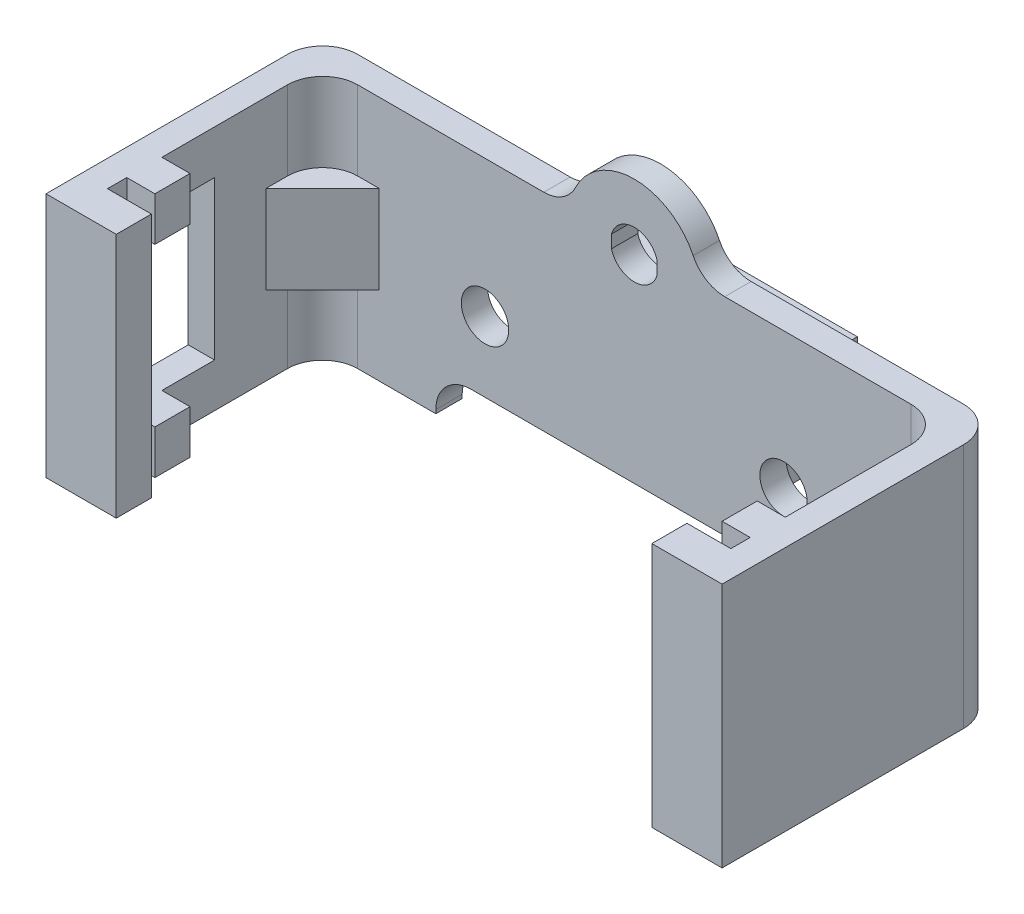
from build123d import *

# Parameters (mm, degrees)
SKETCH_1_W               = 27
SKETCH_1_H               = 17
EXTRUDE_1_DEPTH          = 1
SKETCH_2_R               = 2.55
CUT_EXTRUDE_1_DEPTH      = 16.984367363
EXTRUDE_2_DEPTH          = 17
SKETCH_6_W               = 1.5
SKETCH_6_H               = 2
EXTRUDE_3_DEPTH          = 2
CHAMFER_1_SIZE           = 1
CUT_EXTRUDE_4_REACH      = 39.316
SKETCH_8_R               = 2
FILLET_1_R               = 3
SKETCH_9_W               = 7
SKETCH_9_H               = 13
EXTRUDE_4_DEPTH          = 1.5
SKETCH_7_R               = 1.35
CUT_EXTRUDE_5_DEPTH      = 10
CUT_EXTRUDE_6_REACH      = 41.373
FILLET_2_R               = 2.2
SKETCH_13_W              = 11.6
SKETCH_13_H              = 5.4
EXTRUDE_6_DEPTH          = 5.4
CUT_EXTRUDE_7_DEPTH      = 45.299097095
CUT_EXTRUDE_7_DEPTH_BACK = 45.299097095
SKETCH_14_OUTSIDE_W      = 46.85
SKETCH_14_OUTSIDE_H      = 49.25
SKETCH_14_OUTSIDE_W_2    = 27
SKETCH_14_OUTSIDE_H_2    = 6.9
EXTRUDE_7_DEPTH          = 3.5
EXTRUDE_7_DEPTH_BACK     = 10.5
SKETCH_16_W              = 5.6
SKETCH_16_H              = 1.5
SKETCH_16_W_2            = 4.4
SKETCH_16_W_3            = 12.2
EXTRUDE_8_DEPTH          = 2
EXTRUDE_9_DEPTH          = 2.5
CUT_EXTRUDE_8_REACH      = 55.893
SKETCH_18_W              = 5
SKETCH_18_H              = 9
EXTRUDE_START            = -1.5
SKETCH_19_R              = 3.726433752
SKETCH_19_R_2            = 1.35
SKETCH_19_W              = 24.8
SKETCH_19_H              = 1.288897449
EXTRUDE_10_DEPTH         = 1.5
FILLET_4_R               = 2


# Some blends are built 0.0001 mm under size
with BuildPart() as part:
    # 草图1 → 凸台-拉伸1 (new body)
    with BuildSketch(Plane.XY):
        Rectangle(SKETCH_1_W, SKETCH_1_H)
    extrude(amount=EXTRUDE_1_DEPTH)

    # 草图2 → 切除-拉伸1 (cut, through all)
    with BuildSketch(Plane.XY.offset(1)):
        with Locations((0, 4.125)):
            Circle(SKETCH_2_R)
        with Locations((0, -4.125)):
            Circle(SKETCH_2_R)
        with Locations((8.27, 4.125)):
            Circle(SKETCH_2_R)
        with Locations((8.27, -4.125)):
            Circle(SKETCH_2_R)
        with Locations((-8.27, 4.125)):
            Circle(SKETCH_2_R)
        with Locations((-8.27, -4.125)):
            Circle(SKETCH_2_R)
    extrude(amount=-CUT_EXTRUDE_1_DEPTH, mode=Mode.SUBTRACT)

    # 草图3 → 凸台-拉伸2 (add)
    with BuildSketch(Plane.XZ.offset(8.5)):
        Polygon((13.5, 0), (19, 0), (19, -28.5), (-13.5, -28.5), (-13.5, -30), (20.5, -30), (20.5, 1), (13.5, 1), align=None)
    extrude(amount=-EXTRUDE_2_DEPTH)

    # 草图6 → 凸台-拉伸3 (add, symmetric)
    with BuildSketch(Plane(origin=(0, 0, 0), x_dir=(1, 0, 0), z_dir=(0, 1, 0))):
        Polygon((19, 0), (19, 5), (14, 0), align=None)
        Polygon((19, 28.5), (14, 28.5), (19, 23.5), align=None)
        with Locations((18.25, 20)):
            Rectangle(SKETCH_6_W, SKETCH_6_H)
    extrude(amount=EXTRUDE_3_DEPTH, both=True)

    # 倒角1
    chamfer_1_edges = [part.edges().sort_by_distance(p)[0] for p in [
        (-13.5, 0, 0),
    ]]
    chamfer(chamfer_1_edges, length=CHAMFER_1_SIZE - 0.0001)  # a hair under: the kernel refuses the full size

    # 草图8 → 切除-拉伸4 (cut, up to next)
    with BuildSketch(Plane(origin=(0, 0, 0), x_dir=(-1, 0, 0), z_dir=(0, 0, -1)), mode=Mode.PRIVATE) as cut_extrude_4_sk1:
        Circle(SKETCH_8_R)
    cut_extrude_4_tool1 = extrude(cut_extrude_4_sk1.sketch, amount=-CUT_EXTRUDE_4_REACH, mode=Mode.PRIVATE) & part.part
    add(cut_extrude_4_tool1.solids().sort_by_distance((0, 0, 0))[0], mode=Mode.SUBTRACT)

    # 圆角1
    fillet_1_edges = [part.edges().sort_by_distance(p)[0] for p in [
        (20.5, 0, 1),
        (20.5, 0, -30),
        (19, 5.25, -28.5),
        (19, 5.25, 0),
        (19, -5.25, 0),
        (19, -5.25, -28.5),
    ]]
    fillet(fillet_1_edges, radius=FILLET_1_R)

    # 草图9 → 凸台-拉伸4 (add)
    with BuildSketch(Plane(origin=(0, 0, -30), x_dir=(-1, 0, 0), z_dir=(0, 0, -1))):
        with Locations((0, 6.5)):
            Rectangle(SKETCH_9_W, SKETCH_9_H)
    extrude(amount=-EXTRUDE_4_DEPTH)

    # 草图7 → 切除-拉伸5 (cut)
    with BuildSketch(Plane(origin=(0, 0, -30), x_dir=(-1, 0, 0), z_dir=(0, 0, -1))):
        with Locations((0, 10)):
            Circle(SKETCH_7_R)
        with Locations((-8.5, 2.7)):
            Circle(SKETCH_7_R)
        with Locations((8.5, 2.7)):
            Circle(SKETCH_7_R)
    extrude(amount=-CUT_EXTRUDE_5_DEPTH, mode=Mode.SUBTRACT)

    # 草图11 → 切除-拉伸6 (cut, up to next)
    with BuildSketch(Plane(origin=(0, 0, -30), x_dir=(-1, 0, 0), z_dir=(0, 0, -1)), mode=Mode.PRIVATE) as cut_extrude_6_sk1:
        with BuildLine():
            Line((13.5, -8.5), (13.5, 0))
            Line((13.5, 0), (-9, 0))
            ThreePointArc((-9, 0), (-15.01040764, -2.48959236), (-17.5, -8.5))
            Line((-17.5, -8.5), (13.5, -8.5))
        make_face()
    cut_extrude_6_tool1 = extrude(cut_extrude_6_sk1.sketch, amount=-CUT_EXTRUDE_6_REACH, mode=Mode.PRIVATE) & part.part
    add(cut_extrude_6_tool1.solids().sort_by_distance((1.149624, -4.397011, -30))[0], mode=Mode.SUBTRACT)

    # 圆角2
    fillet_2_edges = [part.edges().sort_by_distance(p)[0] for p in [
        (-3.5, 13, -29.25),
        (-3.5, 8.5, -29.25),
        (3.5, 13, -29.25),
        (3.5, 8.5, -29.25),
        (-13.5, 0, -29.25),
        (-13.5, 8.5, -29.25),
    ]]
    fillet(fillet_2_edges, radius=FILLET_2_R)

    # 草图13 → 凸台-拉伸6 (add)
    with BuildSketch(Plane(origin=(0, 0, -30), x_dir=(-1, 0, 0), z_dir=(0, 0, -1))):
        with Locations((0, 2.7)):
            Rectangle(SKETCH_13_W, SKETCH_13_H)
    extrude(amount=EXTRUDE_6_DEPTH)

    # 草图14 outside → 切除-拉伸7 (cut, two sides: drawn at the far end of the back side and taken through both)
    with BuildSketch(Plane(origin=(0, 8.5, 0), x_dir=(1, 0, 0), z_dir=(0, 1, 0)).offset(-CUT_EXTRUDE_7_DEPTH_BACK)):
        with Locations((3.5, 17.2)):
            Rectangle(SKETCH_14_OUTSIDE_W, SKETCH_14_OUTSIDE_H)
        with Locations((0, 31.95)):
            Rectangle(SKETCH_14_OUTSIDE_W_2, SKETCH_14_OUTSIDE_H_2, mode=Mode.SUBTRACT)
    extrude(amount=CUT_EXTRUDE_7_DEPTH + CUT_EXTRUDE_7_DEPTH_BACK, mode=Mode.SUBTRACT)

    # 草图15 → 凸台-拉伸7 (add, two sides: drawn at the far end of the back side and taken through both)
    with BuildSketch(Plane.XZ.offset(-EXTRUDE_7_DEPTH_BACK)):
        Polygon((-19.25, -14.25), (-19.25, -30), (-11.3, -30), (-11.3, -28.5), (-17.75, -28.5), (-17.75, -19.35), (-16.15, -19.35), (-16.15, -17.35), (-17.75, -17.35), (-17.75, -16.25), (-15.25, -16.25), (-15.25, -14.25), align=None)
        Polygon((17.75, -28.5), (13.5, -28.5), (13.5, -30), (19.25, -30), (19.25, -14.25), (15.25, -14.25), (15.25, -16.25), (17.75, -16.25), (17.75, -17.35), (16.15, -17.35), (16.15, -19.35), (17.75, -19.35), align=None)
    extrude(amount=EXTRUDE_7_DEPTH + EXTRUDE_7_DEPTH_BACK)

    # 草图16 → 凸台-拉伸8 (add)
    with BuildSketch(Plane(origin=(0, 8.5, 0), x_dir=(1, 0, 0), z_dir=(0, 1, 0))):
        with Locations((-8.5, 29.25)):
            Rectangle(SKETCH_16_W, SKETCH_16_H)
        with Locations((-3.5, 29.25)):
            Rectangle(SKETCH_16_W_2, SKETCH_16_H)
        with Locations((7.4, 29.25)):
            Rectangle(SKETCH_16_W_3, SKETCH_16_H)
    extrude(amount=EXTRUDE_8_DEPTH)

    # 草图17 → 凸台-拉伸9 (add, symmetric)
    with BuildSketch(Plane(origin=(0, 3.5, 0), x_dir=(-1, 0, 0), z_dir=(0, -1, 0))):
        Polygon((17.75, 25.275), (14.525, 28.5), (17.75, 28.5), align=None)
        Polygon((-17.75, 25.275), (-17.75, 28.5), (-14.525, 28.5), align=None)
    extrude(amount=EXTRUDE_9_DEPTH, both=True)

    # 草图18 → 切除-拉伸8 (cut, up to next)
    with BuildSketch(Plane.ZY.offset(19.25), mode=Mode.PRIVATE) as cut_extrude_8_sk1:
        with Locations((-19.85, 3.5)):
            Rectangle(SKETCH_18_W, SKETCH_18_H)
    cut_extrude_8_tool1 = extrude(cut_extrude_8_sk1.sketch, amount=-CUT_EXTRUDE_8_REACH, mode=Mode.PRIVATE) & part.part
    add(cut_extrude_8_tool1.solids().sort_by_distance((-19.25, 3.5, -19.85))[0], mode=Mode.SUBTRACT)

    # 草图19 → 凸台-拉伸10 (add)
    # profile 1 of 2: a face of its own
    with BuildSketch(Plane.XY.offset(-28.5).offset(EXTRUDE_START)):
        with Locations((0, 10)):
            Circle(SKETCH_19_R)
        with Locations((0, 10)):
            Circle(SKETCH_19_R_2, mode=Mode.SUBTRACT)
    # profile 2 of 2: a face of its own
    with BuildSketch(Plane.XY.offset(-28.5).offset(EXTRUDE_START)):
        with Locations((1.1, -0.644448725)):
            Rectangle(SKETCH_19_W, SKETCH_19_H)
    extrude(amount=EXTRUDE_10_DEPTH)

    # 圆角4
    # the kernel refuses this fillet: 2 mm, written as the material it adds along each edge
    with BuildSketch(Plane(origin=(-5.8, 5.4, -30), x_dir=(0, 1, 0), z_dir=(1, 0, 0))) as fillet_4_piece_1:
        with BuildLine():
            CenterArc((FILLET_4_R, -FILLET_4_R), FILLET_4_R, 90, 90)
            Line((0, -FILLET_4_R), (0, 0))
            Line((0, 0), (FILLET_4_R, 0))
        make_face()
    extrude(amount=11.6)
    with BuildSketch(Plane(origin=(13.5, -1.288897449, -28.5), x_dir=(0, -1, 0), z_dir=(0, 0, -1))) as fillet_4_piece_2:
        with BuildLine():
            CenterArc((FILLET_4_R, FILLET_4_R), FILLET_4_R, 180, 90)
            Line((0, FILLET_4_R), (0, 0))
            Line((0, 0), (FILLET_4_R, 0))
        make_face()
    extrude(amount=1.5)
    with BuildSketch(Plane(origin=(17.75, 1, -28.5), x_dir=(-1, 0, 0), z_dir=(0, 1, 0)), Plane(origin=(-17.75, 6, -28.5), x_dir=(1, 0, 0), z_dir=(0, -1, 0)), Plane(origin=(-17.75, 10.5, -28.5), x_dir=(1, 0, 0), z_dir=(0, -1, 0)), Plane(origin=(17.75, -3.5, -28.5), x_dir=(-1, 0, 0), z_dir=(0, 1, 0))) as fillet_4_piece_3:
        with BuildLine():
            CenterArc((FILLET_4_R, FILLET_4_R), FILLET_4_R, 180, 90)
            Line((0, FILLET_4_R), (0, 0))
            Line((0, 0), (FILLET_4_R, 0))
        make_face()
    extrude(amount=9.5)
    with BuildSketch(Plane(origin=(-3.692737265, 10.5, -28.5), x_dir=(-1, 0, 0), z_dir=(0, 0, -1))) as fillet_4_piece_4:
        with BuildLine():
            CenterArc((1.459159814, 2), FILLET_4_R, 205.88535786, 64.11464214)
            ThreePointArc((-0.340178937, 1.126856222), (-0.125315404, 0.576944648), (0, 0))
            Line((0, 0), (1.459159814, 0))
        make_face()
    extrude(amount=1.5)
    with BuildSketch(Plane(origin=(3.692737265, 10.5, -28.5), x_dir=(-0.28900142054358374, 0.9573286681823493, 0), z_dir=(0, 0, -1))) as fillet_4_piece_5:
        with BuildLine():
            CenterArc((1.492958077, 1.974898363), FILLET_4_R, 196.798181975, 64.11464214)
            Line((-0.421699259, 1.396895522), (0, 0))
            ThreePointArc((0, 0), (0.588541981, 0.046769794), (1.177083962, 0))
        make_face()
    extrude(amount=1.5)
    with BuildSketch(Plane(origin=(-5.8, 0, -30), x_dir=(0, -1, 0), z_dir=(1, 0, 0))) as fillet_4_piece_6:
        with BuildLine():
            CenterArc((2, 1.869313554), FILLET_4_R, 180, 69.172765444)
            Line((0, 1.869313554), (0, 0))
            Line((0, 0), (1.288897449, 0))
        make_face()
    extrude(amount=11.6)
    with BuildSketch(Plane(origin=(-11.3, -1.288897449, -30), x_dir=(1, 0, 0), z_dir=(0, 0, 1))) as fillet_4_piece_7:
        with BuildLine():
            CenterArc((FILLET_4_R, -FILLET_4_R), FILLET_4_R, 90, 90)
            Line((0, -FILLET_4_R), (0, 0))
            Line((0, 0), (FILLET_4_R, 0))
        make_face()
    extrude(amount=1.5)
    # the kernel refuses this fillet: 2 mm, written as the material it takes off along each edge
    with BuildSketch(Plane(origin=(19.25, 15.5, -30), x_dir=(-1, 0, 0), z_dir=(0, -1, 0))) as fillet_4_2_piece_1:
        with BuildLine():
            CenterArc((FILLET_4_R, -FILLET_4_R), FILLET_4_R, 90, 90)
            Line((0, -FILLET_4_R), (0, 0))
            Line((0, 0), (FILLET_4_R, 0))
        make_face()
    extrude(amount=24, mode=Mode.SUBTRACT)
    with BuildSketch(Plane(origin=(-19.25, 15.5, -30), x_dir=(1, 0, 0), z_dir=(0, -1, 0))) as fillet_4_2_piece_2:
        with BuildLine():
            CenterArc((FILLET_4_R, FILLET_4_R), FILLET_4_R, 180, 90)
            Line((0, FILLET_4_R), (0, 0))
            Line((0, 0), (FILLET_4_R, 0))
        make_face()
    extrude(amount=24, mode=Mode.SUBTRACT)


solid = part.part
